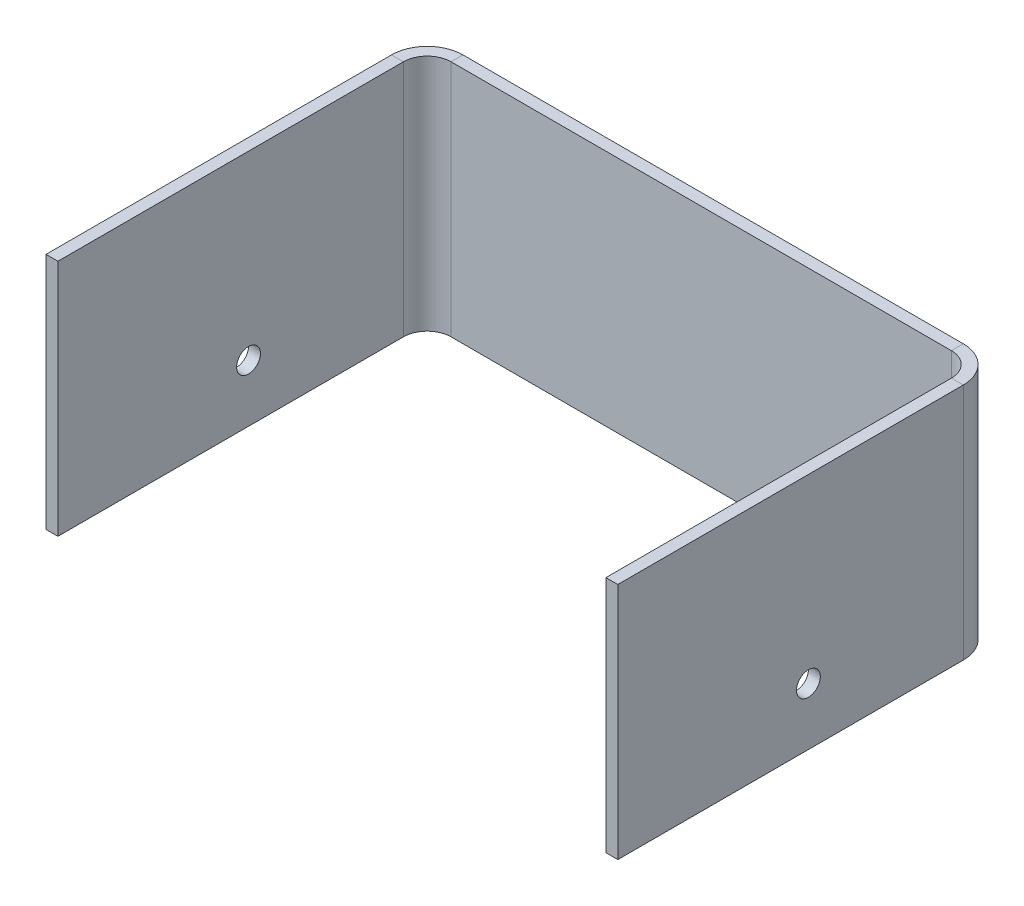
from build123d import *

# Parameters (mm, degrees)
SKETCH1_W                      = 152.4
SKETCH1_H                      = 63.5
BOSS_EXTRUDE1_DEPTH            = 3.175
EDGE_FLANGE1_STRIP_W           = 25.4
EDGE_FLANGE1_STRIP_H           = 3.175
EDGE_FLANGE1_STRIP_CUT_DEPTH   = 63.5
EDGE_FLANGE1_STRIP_2_W         = 25.4
EDGE_FLANGE1_STRIP_2_H         = 3.175
EDGE_FLANGE1_STRIP_CUT_2_DEPTH = 63.5
EDGE_FLANGE1_DEPTH             = 63.5
EDGE_FLANGE1_BEND_DEPTH        = 63.5
CUT_EXTRUDE1_DEPTH             = 194.857086535
CUT_EXTRUDE1_DEPTH_BACK        = 194.857086535
SKETCH22_R                     = 3.175


# Sheet-metal steps are written as plain solids
with BuildPart() as part:
    # Sketch1 → Boss-Extrude1 (new body)
    with BuildSketch(Plane.XY):
        with Locations((76.2, 31.75)):
            Rectangle(SKETCH1_W, SKETCH1_H)
    extrude(amount=BOSS_EXTRUDE1_DEPTH)

    # Edge-Flange1 strip (across the edge) → Edge-Flange1 strip cut (cut)
    with BuildSketch(Plane(origin=(0, 63.5, 3.175), x_dir=(1, 0, 0), z_dir=(0, -1, 0))):
        with Locations((-3.175, -1.5875)):
            Rectangle(EDGE_FLANGE1_STRIP_W, EDGE_FLANGE1_STRIP_H)
    extrude(amount=EDGE_FLANGE1_STRIP_CUT_DEPTH, mode=Mode.SUBTRACT)

    # Edge-Flange1 strip 2 (across the edge) → Edge-Flange1 strip cut 2 (cut)
    with BuildSketch(Plane(origin=(152.4, 0, 3.175), x_dir=(-1, 0, 0), z_dir=(0, 1, 0))):
        with Locations((-3.175, -1.5875)):
            Rectangle(EDGE_FLANGE1_STRIP_2_W, EDGE_FLANGE1_STRIP_2_H)
    extrude(amount=EDGE_FLANGE1_STRIP_CUT_2_DEPTH, mode=Mode.SUBTRACT)

    # Edge-Flange1 section (across the edge) → Edge-Flange1 (add)
    with BuildSketch(Plane(origin=(0, 63.5, 3.175), x_dir=(1, 0, 0), z_dir=(0, -1, 0))):
        with BuildLine():
            Line((0, 6.35), (0, 98.425))
            Line((0, 98.425), (3.175, 98.425))
            Line((3.175, 98.425), (3.175, 6.35))
            ThreePointArc((3.175, 6.35), (5.034871939, 1.859871939), (9.525, 0))
            Line((9.525, 0), (9.525, -3.175))
            ThreePointArc((9.525, -3.175), (2.789807909, -0.385192091), (0, 6.35))
        make_face()
    extrude(amount=EDGE_FLANGE1_DEPTH)

    # Edge-Flange1 section 2 (across the edge) → Edge-Flange1 bend (add)
    with BuildSketch(Plane(origin=(152.4, 0, 3.175), x_dir=(-1, 0, 0), z_dir=(0, 1, 0))):
        with BuildLine():
            Line((0, 6.35), (0, 98.425))
            Line((0, 98.425), (3.175, 98.425))
            Line((3.175, 98.425), (3.175, 6.35))
            ThreePointArc((3.175, 6.35), (5.034871939, 1.859871939), (9.525, 0))
            Line((9.525, 0), (9.525, -3.175))
            ThreePointArc((9.525, -3.175), (2.789807909, -0.385192091), (0, 6.35))
        make_face()
    extrude(amount=EDGE_FLANGE1_BEND_DEPTH)

    # Sketch22 → Cut-Extrude1 (cut, two sides: drawn at the far end of the back side and taken through both)
    with BuildSketch(Plane.ZY.offset(-CUT_EXTRUDE1_DEPTH_BACK)):
        with Locations((50.8, 15.24)):
            Circle(SKETCH22_R)
    extrude(amount=CUT_EXTRUDE1_DEPTH + CUT_EXTRUDE1_DEPTH_BACK, mode=Mode.SUBTRACT)


solid = part.part
